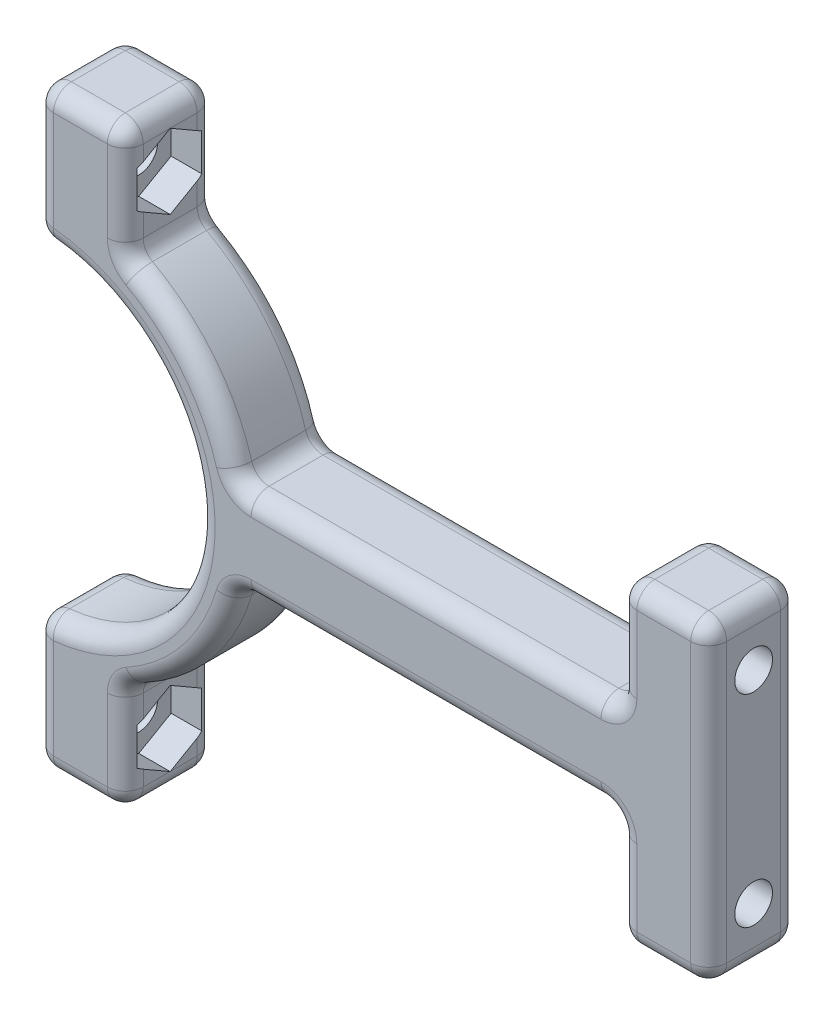
from build123d import *

# Parameters (mm, degrees)
BOSS_EXTRUDE1_DEPTH             = 10
SKETCH2_W                       = 10
SKETCH2_H                       = 10
BOSS_EXTRUDE2_DEPTH             = 10
BOSS_EXTRUDE2_DIRECTION_2_REACH = 54.393
SKETCH4_R                       = 2.1
CUT_EXTRUDE2_DEPTH              = 10
CUT_EXTRUDE3_DEPTH              = 3.5
SKETCH6_W                       = 52.5
SKETCH6_H                       = 10
BOSS_EXTRUDE3_DEPTH             = 10
SKETCH8_W                       = 10
SKETCH8_H                       = 10
BOSS_EXTRUDE4_DEPTH             = 12.5
SKETCH9_R                       = 2.1
CUT_EXTRUDE4_DEPTH              = 12.5
CUT_EXTRUDE5_DEPTH              = 3.5
FILLET1_R                       = 2
FILLET2_R                       = 2


with BuildPart() as part:
    # Sketch1 → Boss-Extrude1 (new body)
    with BuildSketch(Plane.XY):
        with BuildLine():
            Line((0, 18), (0, 23))
            ThreePointArc((0, 23), (23, 0), (0, -23))
            Line((0, -23), (0, -18))
            ThreePointArc((0, -18), (18, 0), (0, 18))
        make_face()
    extrude(amount=BOSS_EXTRUDE1_DEPTH)

    # Sketch2 → Boss-Extrude2 (add)
    with BuildSketch(Plane(origin=(0, -23, 0), x_dir=(-1, 0, 0), z_dir=(0, -1, 0))):
        with Locations((-5, -5)):
            Rectangle(SKETCH2_W, SKETCH2_H)
    boss_extrude2 = extrude(amount=BOSS_EXTRUDE2_DEPTH)

    # Sketch2 → Boss-Extrude2 direction 2 (add, up to next)
    with BuildSketch(Plane(origin=(0, -23, 0), x_dir=(-1, 0, 0), z_dir=(0, -1, 0)), mode=Mode.PRIVATE) as boss_extrude2_direction_2_sk1:
        with Locations((-5, -5)):
            Rectangle(SKETCH2_W, SKETCH2_H)
    boss_extrude2_direction_2_tool1 = extrude(boss_extrude2_direction_2_sk1.sketch, amount=-BOSS_EXTRUDE2_DIRECTION_2_REACH, mode=Mode.PRIVATE) - part.part
    boss_extrude2_direction_2 = boss_extrude2_direction_2_tool1.solids().sort_by_distance((5, -23, 5))[0]
    add(boss_extrude2_direction_2)

    # Sketch4 → Cut-Extrude2 (cut)
    with BuildSketch(Plane(origin=(10, 0, 0), x_dir=(0, 0, -1), z_dir=(1, 0, 0))):
        with Locations(Location((-5, -26.856157589, 0), (0, 0, 90))):
            Circle(SKETCH4_R)
    cut_extrude2 = extrude(amount=-CUT_EXTRUDE2_DEPTH, mode=Mode.SUBTRACT)

    # Sketch5 → Cut-Extrude3 (cut)
    with BuildSketch(Plane(origin=(10, 0, 0), x_dir=(0, 0, -1), z_dir=(1, 0, 0))):
        Polygon((-1.4, -24.77769662), (-5, -22.69923565), (-8.6, -24.77769662), (-8.6, -28.934618558), (-5, -31.013079527), (-1.4, -28.934618558), align=None)
    cut_extrude3 = extrude(amount=-CUT_EXTRUDE3_DEPTH, mode=Mode.SUBTRACT)

    # Sketch6 → Boss-Extrude3 (add)
    with BuildSketch(Plane(origin=(0, 0, 0), x_dir=(-1, 0, 0), z_dir=(0, 0, -1))):
        with Locations((-48.699944321, 0)):
            Rectangle(SKETCH6_W, SKETCH6_H)
    extrude(amount=-BOSS_EXTRUDE3_DEPTH)

    # Sketch8 → Boss-Extrude4 (add)
    with BuildSketch(Plane.XZ.offset(5)):
        with Locations((69.949944321, 5)):
            Rectangle(SKETCH8_W, SKETCH8_H)
    boss_extrude4 = extrude(amount=BOSS_EXTRUDE4_DEPTH)

    # Sketch9 → Cut-Extrude4 (cut)
    with BuildSketch(Plane.ZY.offset(-64.949944321)):
        with Locations(Location((5, -11.25, 0), (0, 0, 270))):
            Circle(SKETCH9_R)
    cut_extrude4 = extrude(amount=-CUT_EXTRUDE4_DEPTH, mode=Mode.SUBTRACT)

    # Sketch10 → Cut-Extrude5 (cut)
    with BuildSketch(Plane.ZY.offset(-64.949944321)):
        Polygon((1.4, -9.171539031), (1.4, -13.328460969), (5, -15.406921938), (8.6, -13.328460969), (8.6, -9.171539031), (5, -7.093078062), align=None)
    cut_extrude5 = extrude(amount=-CUT_EXTRUDE5_DEPTH, mode=Mode.SUBTRACT)

    # Mirror1: Boss-Extrude2, Boss-Extrude2 direction 2, Cut-Extrude2, Cut-Extrude3, Boss-Extrude4, Cut-Extrude4, Cut-Extrude5 across plane
    add(boss_extrude2.mirror(Plane.ZX))
    add(boss_extrude2_direction_2.mirror(Plane.ZX))
    add(cut_extrude2.mirror(Plane.ZX), mode=Mode.SUBTRACT)
    add(cut_extrude3.mirror(Plane.ZX), mode=Mode.SUBTRACT)
    add(boss_extrude4.mirror(Plane.ZX))
    add(cut_extrude4.mirror(Plane.ZX), mode=Mode.SUBTRACT)
    add(cut_extrude5.mirror(Plane.ZX), mode=Mode.SUBTRACT)

    # Fillet1
    fillet1_edges = [part.edges().sort_by_distance(p)[0] for p in [
        (10, 33, 5),
        (10, 20.712315177, 5),
        (0, 33, 5),
        (74.949944321, 17.5, 5),
        (64.949944321, 17.5, 5),
        (64.949944321, 5, 5),
        (10, -20.712315177, 5),
        (0, -33, 5),
        (10, -33, 5),
        (22.449944321, -5, 5),
        (22.449944321, 5, 5),
        (64.949944321, -5, 5),
        (74.949944321, -17.5, 5),
        (64.949944321, -17.5, 5),
        (0, 18, 5),
        (0, -18, 5),
    ]]
    fillet(fillet1_edges, radius=FILLET1_R)

    # Fillet2
    # the kernel refuses this fillet: 2 mm, written as the material it takes off along each edge
    with BuildSketch(Plane(origin=(12, -21.931712199, 10), x_dir=(-1, 0, 0), z_dir=(0, -1, 0))) as fillet2_piece_1:
        with BuildLine():
            CenterArc((2 + FILLET2_R, FILLET2_R), FILLET2_R, 180, 90)
            Line((2 + FILLET2_R, 0), (2, 0))
            Line((2, 0), (2, FILLET2_R))
        make_face()
    revolve(axis=Axis((12, -21.931712199, 10), (0, 0, -1)), revolution_arc=61.314597986, mode=Mode.SUBTRACT)
    with BuildSketch(Plane(origin=(10, -21.931712199, 10), x_dir=(0, 0, -1), z_dir=(0, -1, 0)), Plane(origin=(10, 31, 10), x_dir=(0, 0, -1), z_dir=(0, -1, 0)), Plane(origin=(10, 31, 0), x_dir=(-1, 0, 0), z_dir=(0, -1, 0)), Plane(origin=(10, -21.931712199, 0), x_dir=(-1, 0, 0), z_dir=(0, -1, 0))) as fillet2_piece_2:
        with BuildLine():
            CenterArc((FILLET2_R, -FILLET2_R), FILLET2_R, 90, 90)
            Line((0, -FILLET2_R), (0, 0))
            Line((0, 0), (FILLET2_R, 0))
        make_face()
    extrude(amount=9.068287801, mode=Mode.SUBTRACT)
    with BuildSketch(Plane(origin=(8, -31, 10), x_dir=(0, -1, 0), z_dir=(-1, 0, 0))) as fillet2_piece_3:
        with BuildLine():
            CenterArc((2 - FILLET2_R, -FILLET2_R), FILLET2_R, 360, 90)
            Line((2, -FILLET2_R), (2, 0))
            Line((2, 0), (2 - FILLET2_R, 0))
        make_face()
    revolve(axis=Axis((8, -31, 10), (0, 0, 1)), revolution_arc=90, mode=Mode.SUBTRACT)
    with BuildSketch(Plane(origin=(8, -33, 10), x_dir=(0, 0, -1), z_dir=(-1, 0, 0)), Plane(origin=(2, 33, 0), x_dir=(0, -1, 0), z_dir=(1, 0, 0)), Plane(origin=(66.949944321, 17.5, 10), x_dir=(0, 0, -1), z_dir=(1, 0, 0)), Plane(origin=(72.949944321, -17.5, 0), x_dir=(0, 1, 0), z_dir=(-1, 0, 0))) as fillet2_piece_4:
        with BuildLine():
            CenterArc((FILLET2_R, -FILLET2_R), FILLET2_R, 90, 90)
            Line((0, -FILLET2_R), (0, 0))
            Line((0, 0), (FILLET2_R, 0))
        make_face()
    extrude(amount=6, mode=Mode.SUBTRACT)
    with BuildSketch(Plane(origin=(2, -31, 10), x_dir=(-1, 0, 0), z_dir=(0, 1, 0))) as fillet2_piece_5:
        with BuildLine():
            CenterArc((2 - FILLET2_R, -FILLET2_R), FILLET2_R, 0, 90)
            Line((2 - FILLET2_R, 0), (2, 0))
            Line((2, 0), (2, -FILLET2_R))
        make_face()
    revolve(axis=Axis((2, -31, 10), (0, 0, 1)), revolution_arc=90, mode=Mode.SUBTRACT)
    with BuildSketch(Plane(origin=(0, -31, 10), x_dir=(0, 0, -1), z_dir=(0, 1, 0)), Plane(origin=(0, 19.899748742, 10), x_dir=(0, 0, -1), z_dir=(0, 1, 0)), Plane(origin=(0, 19.899748742, 0), x_dir=(1, 0, 0), z_dir=(0, 1, 0)), Plane(origin=(0, -31, 0), x_dir=(1, 0, 0), z_dir=(0, 1, 0))) as fillet2_piece_6:
        with BuildLine():
            CenterArc((FILLET2_R, -FILLET2_R), FILLET2_R, 90, 90)
            Line((0, -FILLET2_R), (0, 0))
            Line((0, 0), (FILLET2_R, 0))
        make_face()
    extrude(amount=11.100251258, mode=Mode.SUBTRACT)
    with BuildSketch(Plane(origin=(2, -19.899748742, 10), x_dir=(-0.09999999999999949, 0.9949874371066201, 0), z_dir=(0.9949874371066201, 0.09999999999999949, 0))) as fillet2_piece_7:
        with BuildLine():
            CenterArc((2 - FILLET2_R, -FILLET2_R), FILLET2_R, 0, 90)
            Line((2 - FILLET2_R, 0), (2, 0))
            Line((2, 0), (2, -FILLET2_R))
        make_face()
    revolve(axis=Axis((2, -19.899748742, 10), (0, 0, 1)), revolution_arc=84.260829523, mode=Mode.SUBTRACT)
    with BuildSketch(Plane(origin=(0, 0, 10), x_dir=(0.09999999999999992, -0.99498743710662, 0), z_dir=(-0.99498743710662, -0.09999999999999992, 0))) as fillet2_piece_8:
        with BuildLine():
            CenterArc((18 + FILLET2_R, -FILLET2_R), FILLET2_R, 90, 90)
            Line((18 + FILLET2_R, 0), (18, 0))
            Line((18, 0), (18, -FILLET2_R))
        make_face()
    revolve(axis=Axis((0, 0, 10), (0, 0, 1)), revolution_arc=168.521659045, mode=Mode.SUBTRACT)
    with BuildSketch(Plane(origin=(2, 19.899748742, 10), x_dir=(-1, 0, 0), z_dir=(0, 1, 0))) as fillet2_piece_9:
        with BuildLine():
            CenterArc((2 - FILLET2_R, -FILLET2_R), FILLET2_R, 0, 90)
            Line((2 - FILLET2_R, 0), (2, 0))
            Line((2, 0), (2, -FILLET2_R))
        make_face()
    revolve(axis=Axis((2, 19.899748742, 10), (0, 0, 1)), revolution_arc=84.260829523, mode=Mode.SUBTRACT)
    with BuildSketch(Plane(origin=(2, 31, 10), x_dir=(0, 1, 0), z_dir=(1, 0, 0))) as fillet2_piece_10:
        with BuildLine():
            CenterArc((2 - FILLET2_R, -FILLET2_R), FILLET2_R, 0, 90)
            Line((2 - FILLET2_R, 0), (2, 0))
            Line((2, 0), (2, -FILLET2_R))
        make_face()
    revolve(axis=Axis((2, 31, 10), (0, 0, 1)), revolution_arc=90, mode=Mode.SUBTRACT)
    with BuildSketch(Plane(origin=(8, 33, 10), x_dir=(0, 0, -1), z_dir=(-1, 0, 0)), Plane(origin=(72.949944321, 17.5, 0), x_dir=(0, -1, 0), z_dir=(-1, 0, 0)), Plane(origin=(66.949944321, -17.5, 10), x_dir=(0, 0, -1), z_dir=(1, 0, 0)), Plane(origin=(2, -33, 0), x_dir=(0, 1, 0), z_dir=(1, 0, 0))) as fillet2_piece_11:
        with BuildLine():
            CenterArc((FILLET2_R, FILLET2_R), FILLET2_R, 180, 90)
            Line((0, FILLET2_R), (0, 0))
            Line((0, 0), (FILLET2_R, 0))
        make_face()
    extrude(amount=6, mode=Mode.SUBTRACT)
    with BuildSketch(Plane(origin=(8, 31, 10), x_dir=(1, 0, 0), z_dir=(0, -1, 0))) as fillet2_piece_12:
        with BuildLine():
            CenterArc((2 - FILLET2_R, -FILLET2_R), FILLET2_R, 360, 90)
            Line((2, -FILLET2_R), (2, 0))
            Line((2, 0), (2 - FILLET2_R, 0))
        make_face()
    revolve(axis=Axis((8, 31, 10), (0, 0, 1)), revolution_arc=90, mode=Mode.SUBTRACT)
    with BuildSketch(Plane(origin=(12, 21.931712199, 10), x_dir=(-1, 0, 0), z_dir=(0, 1, 0))) as fillet2_piece_13:
        with BuildLine():
            CenterArc((2 + FILLET2_R, -FILLET2_R), FILLET2_R, 90, 90)
            Line((2 + FILLET2_R, 0), (2, 0))
            Line((2, 0), (2, -FILLET2_R))
        make_face()
    revolve(axis=Axis((12, 21.931712199, 10), (0, 0, 1)), revolution_arc=61.314597986, mode=Mode.SUBTRACT)
    with BuildSketch(Plane(origin=(0, 0, 10), x_dir=(0.4799999999999997, 0.8772684879784525, 0), z_dir=(-0.8772684879784525, 0.4799999999999997, 0))) as fillet2_piece_14:
        with BuildLine():
            CenterArc((23 - FILLET2_R, FILLET2_R), FILLET2_R, 270, 90)
            Line((23 - FILLET2_R, 0), (23, 0))
            Line((23, 0), (23, FILLET2_R))
        make_face()
    revolve(axis=Axis((0, 0, 10), (0, 0, -1)), revolution_arc=45.054393278, mode=Mode.SUBTRACT)
    with BuildSketch(Plane(origin=(24, 7, 10), x_dir=(0, -1, 0), z_dir=(1, 0, 0))) as fillet2_piece_15:
        with BuildLine():
            CenterArc((2 + FILLET2_R, FILLET2_R), FILLET2_R, 180, 90)
            Line((2 + FILLET2_R, 0), (2, 0))
            Line((2, 0), (2, FILLET2_R))
        make_face()
    revolve(axis=Axis((24, 7, 10), (0, 0, -1)), revolution_arc=73.739795292, mode=Mode.SUBTRACT)
    with BuildSketch(Plane(origin=(24, 5, 0), x_dir=(0, -1, 0), z_dir=(1, 0, 0)), Plane(origin=(24, 5, 10), x_dir=(0, 0, -1), z_dir=(1, 0, 0)), Plane(origin=(62.949944321, -5, 0), x_dir=(0, 1, 0), z_dir=(-1, 0, 0)), Plane(origin=(62.949944321, -5, 10), x_dir=(0, 0, -1), z_dir=(-1, 0, 0))) as fillet2_piece_16:
        with BuildLine():
            CenterArc((FILLET2_R, -FILLET2_R), FILLET2_R, 90, 90)
            Line((0, -FILLET2_R), (0, 0))
            Line((0, 0), (FILLET2_R, 0))
        make_face()
    extrude(amount=38.949944321, mode=Mode.SUBTRACT)
    with BuildSketch(Plane(origin=(62.949944321, 7, 10), x_dir=(1, 0, 0), z_dir=(0, 1, 0))) as fillet2_piece_17:
        with BuildLine():
            CenterArc((2 + FILLET2_R, FILLET2_R), FILLET2_R, 180, 90)
            Line((2 + FILLET2_R, 0), (2, 0))
            Line((2, 0), (2, FILLET2_R))
        make_face()
    revolve(axis=Axis((62.949944321, 7, 10), (0, 0, -1)), revolution_arc=90, mode=Mode.SUBTRACT)
    with BuildSketch(Plane(origin=(64.949944321, 7, 0), x_dir=(1, 0, 0), z_dir=(0, 1, 0)), Plane(origin=(64.949944321, 7, 10), x_dir=(0, 0, -1), z_dir=(0, 1, 0))) as fillet2_piece_18:
        with BuildLine():
            CenterArc((FILLET2_R, -FILLET2_R), FILLET2_R, 90, 90)
            Line((0, -FILLET2_R), (0, 0))
            Line((0, 0), (FILLET2_R, 0))
        make_face()
    extrude(amount=8.5, mode=Mode.SUBTRACT)
    with BuildSketch(Plane(origin=(66.949944321, 15.5, 10), x_dir=(0, 1, 0), z_dir=(1, 0, 0))) as fillet2_piece_19:
        with BuildLine():
            CenterArc((2 - FILLET2_R, -FILLET2_R), FILLET2_R, 0, 90)
            Line((2 - FILLET2_R, 0), (2, 0))
            Line((2, 0), (2, -FILLET2_R))
        make_face()
    revolve(axis=Axis((66.949944321, 15.5, 10), (0, 0, 1)), revolution_arc=90, mode=Mode.SUBTRACT)
    with BuildSketch(Plane(origin=(72.949944321, 15.5, 10), x_dir=(1, 0, 0), z_dir=(0, -1, 0))) as fillet2_piece_20:
        with BuildLine():
            CenterArc((2 - FILLET2_R, -FILLET2_R), FILLET2_R, 0, 90)
            Line((2 - FILLET2_R, 0), (2, 0))
            Line((2, 0), (2, -FILLET2_R))
        make_face()
    revolve(axis=Axis((72.949944321, 15.5, 10), (0, 0, 1)), revolution_arc=90, mode=Mode.SUBTRACT)
    with BuildSketch(Plane(origin=(74.949944321, 15.5, 0), x_dir=(-1, 0, 0), z_dir=(0, -1, 0)), Plane(origin=(74.949944321, 15.5, 10), x_dir=(0, 0, -1), z_dir=(0, -1, 0))) as fillet2_piece_21:
        with BuildLine():
            CenterArc((FILLET2_R, -FILLET2_R), FILLET2_R, 90, 90)
            Line((0, -FILLET2_R), (0, 0))
            Line((0, 0), (FILLET2_R, 0))
        make_face()
    extrude(amount=31, mode=Mode.SUBTRACT)
    with BuildSketch(Plane(origin=(72.949944321, -15.5, 10), x_dir=(0, -1, 0), z_dir=(-1, 0, 0))) as fillet2_piece_22:
        with BuildLine():
            CenterArc((2 - FILLET2_R, -FILLET2_R), FILLET2_R, 0, 90)
            Line((2 - FILLET2_R, 0), (2, 0))
            Line((2, 0), (2, -FILLET2_R))
        make_face()
    revolve(axis=Axis((72.949944321, -15.5, 10), (0, 0, 1)), revolution_arc=90, mode=Mode.SUBTRACT)
    with BuildSketch(Plane(origin=(66.949944321, -15.5, 10), x_dir=(-1, 0, 0), z_dir=(0, 1, 0))) as fillet2_piece_23:
        with BuildLine():
            CenterArc((2 - FILLET2_R, -FILLET2_R), FILLET2_R, 0, 90)
            Line((2 - FILLET2_R, 0), (2, 0))
            Line((2, 0), (2, -FILLET2_R))
        make_face()
    revolve(axis=Axis((66.949944321, -15.5, 10), (0, 0, 1)), revolution_arc=90, mode=Mode.SUBTRACT)
    with BuildSketch(Plane(origin=(64.949944321, -7, 10), x_dir=(0, 0, -1), z_dir=(0, -1, 0)), Plane(origin=(64.949944321, -7, 0), x_dir=(1, 0, 0), z_dir=(0, -1, 0))) as fillet2_piece_24:
        with BuildLine():
            CenterArc((FILLET2_R, FILLET2_R), FILLET2_R, 180, 90)
            Line((0, FILLET2_R), (0, 0))
            Line((0, 0), (FILLET2_R, 0))
        make_face()
    extrude(amount=8.5, mode=Mode.SUBTRACT)
    with BuildSketch(Plane(origin=(62.949944321, -7, 10), x_dir=(0, 1, 0), z_dir=(-1, 0, 0))) as fillet2_piece_25:
        with BuildLine():
            CenterArc((2 + FILLET2_R, FILLET2_R), FILLET2_R, 180, 90)
            Line((2 + FILLET2_R, 0), (2, 0))
            Line((2, 0), (2, FILLET2_R))
        make_face()
    revolve(axis=Axis((62.949944321, -7, 10), (0, 0, -1)), revolution_arc=90, mode=Mode.SUBTRACT)
    with BuildSketch(Plane(origin=(24, -7, 10), x_dir=(-0.9599999999999996, 0.2800000000000013, 0), z_dir=(-0.2800000000000013, -0.9599999999999996, 0))) as fillet2_piece_26:
        with BuildLine():
            CenterArc((2 + FILLET2_R, FILLET2_R), FILLET2_R, 180, 90)
            Line((2 + FILLET2_R, 0), (2, 0))
            Line((2, 0), (2, FILLET2_R))
        make_face()
    revolve(axis=Axis((24, -7, 10), (0, 0, -1)), revolution_arc=73.739795292, mode=Mode.SUBTRACT)
    with BuildSketch(Plane(origin=(62.949944321, -7, 0), x_dir=(0, 1, 0), z_dir=(-1, 0, 0))) as fillet2_piece_27:
        with BuildLine():
            CenterArc((2 + FILLET2_R, -FILLET2_R), FILLET2_R, 90, 90)
            Line((2, -FILLET2_R), (2, 0))
            Line((2, 0), (2 + FILLET2_R, 0))
        make_face()
    revolve(axis=Axis((62.949944321, -7, 0), (0, 0, -1)), revolution_arc=90, mode=Mode.SUBTRACT)
    with BuildSketch(Plane(origin=(66.949944321, -15.5, 0), x_dir=(-1, 0, 0), z_dir=(0, 1, 0))) as fillet2_piece_28:
        with BuildLine():
            CenterArc((2 - FILLET2_R, FILLET2_R), FILLET2_R, 270, 90)
            Line((2, FILLET2_R), (2, 0))
            Line((2, 0), (2 - FILLET2_R, 0))
        make_face()
    revolve(axis=Axis((66.949944321, -15.5, 0), (0, 0, 1)), revolution_arc=90, mode=Mode.SUBTRACT)
    with BuildSketch(Plane(origin=(72.949944321, -15.5, 0), x_dir=(0, -1, 0), z_dir=(-1, 0, 0))) as fillet2_piece_29:
        with BuildLine():
            CenterArc((2 - FILLET2_R, FILLET2_R), FILLET2_R, 270, 90)
            Line((2, FILLET2_R), (2, 0))
            Line((2, 0), (2 - FILLET2_R, 0))
        make_face()
    revolve(axis=Axis((72.949944321, -15.5, 0), (0, 0, 1)), revolution_arc=90, mode=Mode.SUBTRACT)
    with BuildSketch(Plane(origin=(72.949944321, 15.5, 0), x_dir=(1, 0, 0), z_dir=(0, -1, 0))) as fillet2_piece_30:
        with BuildLine():
            CenterArc((2 - FILLET2_R, FILLET2_R), FILLET2_R, 270, 90)
            Line((2, FILLET2_R), (2, 0))
            Line((2, 0), (2 - FILLET2_R, 0))
        make_face()
    revolve(axis=Axis((72.949944321, 15.5, 0), (0, 0, 1)), revolution_arc=90, mode=Mode.SUBTRACT)
    with BuildSketch(Plane(origin=(66.949944321, 15.5, 0), x_dir=(0, 1, 0), z_dir=(1, 0, 0))) as fillet2_piece_31:
        with BuildLine():
            CenterArc((2 - FILLET2_R, FILLET2_R), FILLET2_R, 270, 90)
            Line((2, FILLET2_R), (2, 0))
            Line((2, 0), (2 - FILLET2_R, 0))
        make_face()
    revolve(axis=Axis((66.949944321, 15.5, 0), (0, 0, 1)), revolution_arc=90, mode=Mode.SUBTRACT)
    with BuildSketch(Plane(origin=(62.949944321, 7, 0), x_dir=(1, 0, 0), z_dir=(0, 1, 0))) as fillet2_piece_32:
        with BuildLine():
            CenterArc((2 + FILLET2_R, -FILLET2_R), FILLET2_R, 90, 90)
            Line((2, -FILLET2_R), (2, 0))
            Line((2, 0), (2 + FILLET2_R, 0))
        make_face()
    revolve(axis=Axis((62.949944321, 7, 0), (0, 0, -1)), revolution_arc=90, mode=Mode.SUBTRACT)
    with BuildSketch(Plane(origin=(24, 7, 0), x_dir=(0, -1, 0), z_dir=(1, 0, 0))) as fillet2_piece_33:
        with BuildLine():
            CenterArc((2 + FILLET2_R, -FILLET2_R), FILLET2_R, 90, 90)
            Line((2, -FILLET2_R), (2, 0))
            Line((2, 0), (2 + FILLET2_R, 0))
        make_face()
    revolve(axis=Axis((24, 7, 0), (0, 0, -1)), revolution_arc=73.739795292, mode=Mode.SUBTRACT)
    with BuildSketch(Plane(origin=(0, 0, 0), x_dir=(0.4799999999999997, 0.8772684879784525, 0), z_dir=(-0.8772684879784525, 0.4799999999999997, 0))) as fillet2_piece_34:
        with BuildLine():
            CenterArc((23 - FILLET2_R, -FILLET2_R), FILLET2_R, 0, 90)
            Line((23, -FILLET2_R), (23, 0))
            Line((23, 0), (23 - FILLET2_R, 0))
        make_face()
    revolve(axis=Axis((0, 0, 0), (0, 0, -1)), revolution_arc=45.054393278, mode=Mode.SUBTRACT)
    with BuildSketch(Plane(origin=(12, 21.931712199, 0), x_dir=(-1, 0, 0), z_dir=(0, 1, 0))) as fillet2_piece_35:
        with BuildLine():
            CenterArc((2 + FILLET2_R, FILLET2_R), FILLET2_R, 180, 90)
            Line((2, FILLET2_R), (2, 0))
            Line((2, 0), (2 + FILLET2_R, 0))
        make_face()
    revolve(axis=Axis((12, 21.931712199, 0), (0, 0, 1)), revolution_arc=61.314597986, mode=Mode.SUBTRACT)
    with BuildSketch(Plane(origin=(8, 31, 0), x_dir=(1, 0, 0), z_dir=(0, -1, 0))) as fillet2_piece_36:
        with BuildLine():
            CenterArc((2 - FILLET2_R, FILLET2_R), FILLET2_R, 270, 90)
            Line((2, FILLET2_R), (2, 0))
            Line((2, 0), (2 - FILLET2_R, 0))
        make_face()
    revolve(axis=Axis((8, 31, 0), (0, 0, 1)), revolution_arc=90, mode=Mode.SUBTRACT)
    with BuildSketch(Plane(origin=(2, 31, 0), x_dir=(0, 1, 0), z_dir=(1, 0, 0))) as fillet2_piece_37:
        with BuildLine():
            CenterArc((2 - FILLET2_R, FILLET2_R), FILLET2_R, 270, 90)
            Line((2, FILLET2_R), (2, 0))
            Line((2, 0), (2 - FILLET2_R, 0))
        make_face()
    revolve(axis=Axis((2, 31, 0), (0, 0, 1)), revolution_arc=90, mode=Mode.SUBTRACT)
    with BuildSketch(Plane(origin=(2, 19.899748742, 0), x_dir=(-1, 0, 0), z_dir=(0, 1, 0))) as fillet2_piece_38:
        with BuildLine():
            CenterArc((2 - FILLET2_R, FILLET2_R), FILLET2_R, 270, 90)
            Line((2, FILLET2_R), (2, 0))
            Line((2, 0), (2 - FILLET2_R, 0))
        make_face()
    revolve(axis=Axis((2, 19.899748742, 0), (0, 0, 1)), revolution_arc=84.260829523, mode=Mode.SUBTRACT)
    with BuildSketch(Plane(origin=(0, 0, 0), x_dir=(0.09999999999999992, -0.99498743710662, 0), z_dir=(-0.99498743710662, -0.09999999999999992, 0))) as fillet2_piece_39:
        with BuildLine():
            CenterArc((18 + FILLET2_R, FILLET2_R), FILLET2_R, 180, 90)
            Line((18, FILLET2_R), (18, 0))
            Line((18, 0), (18 + FILLET2_R, 0))
        make_face()
    revolve(axis=Axis((0, 0, 0), (0, 0, 1)), revolution_arc=168.521659045, mode=Mode.SUBTRACT)
    with BuildSketch(Plane(origin=(2, -19.899748742, 0), x_dir=(-0.09999999999999992, 0.99498743710662, 0), z_dir=(0.99498743710662, 0.09999999999999992, 0))) as fillet2_piece_40:
        with BuildLine():
            CenterArc((2 - FILLET2_R, FILLET2_R), FILLET2_R, 270, 90)
            Line((2, FILLET2_R), (2, 0))
            Line((2, 0), (2 - FILLET2_R, 0))
        make_face()
    revolve(axis=Axis((2, -19.899748742, 0), (0, 0, 1)), revolution_arc=84.260829523, mode=Mode.SUBTRACT)
    with BuildSketch(Plane(origin=(2, -31, 0), x_dir=(-1, 0, 0), z_dir=(0, 1, 0))) as fillet2_piece_41:
        with BuildLine():
            CenterArc((2 - FILLET2_R, FILLET2_R), FILLET2_R, 270, 90)
            Line((2, FILLET2_R), (2, 0))
            Line((2, 0), (2 - FILLET2_R, 0))
        make_face()
    revolve(axis=Axis((2, -31, 0), (0, 0, 1)), revolution_arc=90, mode=Mode.SUBTRACT)
    with BuildSketch(Plane(origin=(8, -31, 0), x_dir=(0, -1, 0), z_dir=(-1, 0, 0))) as fillet2_piece_42:
        with BuildLine():
            CenterArc((2 - FILLET2_R, FILLET2_R), FILLET2_R, 270, 90)
            Line((2, FILLET2_R), (2, 0))
            Line((2, 0), (2 - FILLET2_R, 0))
        make_face()
    revolve(axis=Axis((8, -31, 0), (0, 0, 1)), revolution_arc=90, mode=Mode.SUBTRACT)
    with BuildSketch(Plane(origin=(12, -21.931712199, 0), x_dir=(-1, 0, 0), z_dir=(0, -1, 0))) as fillet2_piece_43:
        with BuildLine():
            CenterArc((2 + FILLET2_R, -FILLET2_R), FILLET2_R, 90, 90)
            Line((2, -FILLET2_R), (2, 0))
            Line((2, 0), (2 + FILLET2_R, 0))
        make_face()
    revolve(axis=Axis((12, -21.931712199, 0), (0, 0, -1)), revolution_arc=61.314597986, mode=Mode.SUBTRACT)
    with BuildSketch(Plane(origin=(0, 0, 0), x_dir=(0.96, -0.28000000000000014, 0), z_dir=(0.28000000000000014, 0.96, 0))) as fillet2_piece_44:
        with BuildLine():
            CenterArc((23 - FILLET2_R, -FILLET2_R), FILLET2_R, 0, 90)
            Line((23, -FILLET2_R), (23, 0))
            Line((23, 0), (23 - FILLET2_R, 0))
        make_face()
    revolve(axis=Axis((0, 0, 0), (0, 0, -1)), revolution_arc=45.054393278, mode=Mode.SUBTRACT)
    with BuildSketch(Plane(origin=(24, -7, 0), x_dir=(-0.96, 0.28, 0), z_dir=(-0.28, -0.96, 0))) as fillet2_piece_45:
        with BuildLine():
            CenterArc((2 + FILLET2_R, -FILLET2_R), FILLET2_R, 90, 90)
            Line((2, -FILLET2_R), (2, 0))
            Line((2, 0), (2 + FILLET2_R, 0))
        make_face()
    revolve(axis=Axis((24, -7, 0), (0, 0, -1)), revolution_arc=73.739795292, mode=Mode.SUBTRACT)
    with BuildSketch(Plane(origin=(0, 0, 10), x_dir=(0.96, -0.28000000000000014, 0), z_dir=(0.28000000000000014, 0.96, 0))) as fillet2_piece_46:
        with BuildLine():
            CenterArc((23 - FILLET2_R, FILLET2_R), FILLET2_R, 270, 90)
            Line((23 - FILLET2_R, 0), (23, 0))
            Line((23, 0), (23, FILLET2_R))
        make_face()
    revolve(axis=Axis((0, 0, 10), (0, 0, -1)), revolution_arc=45.054393278, mode=Mode.SUBTRACT)


solid = part.part
